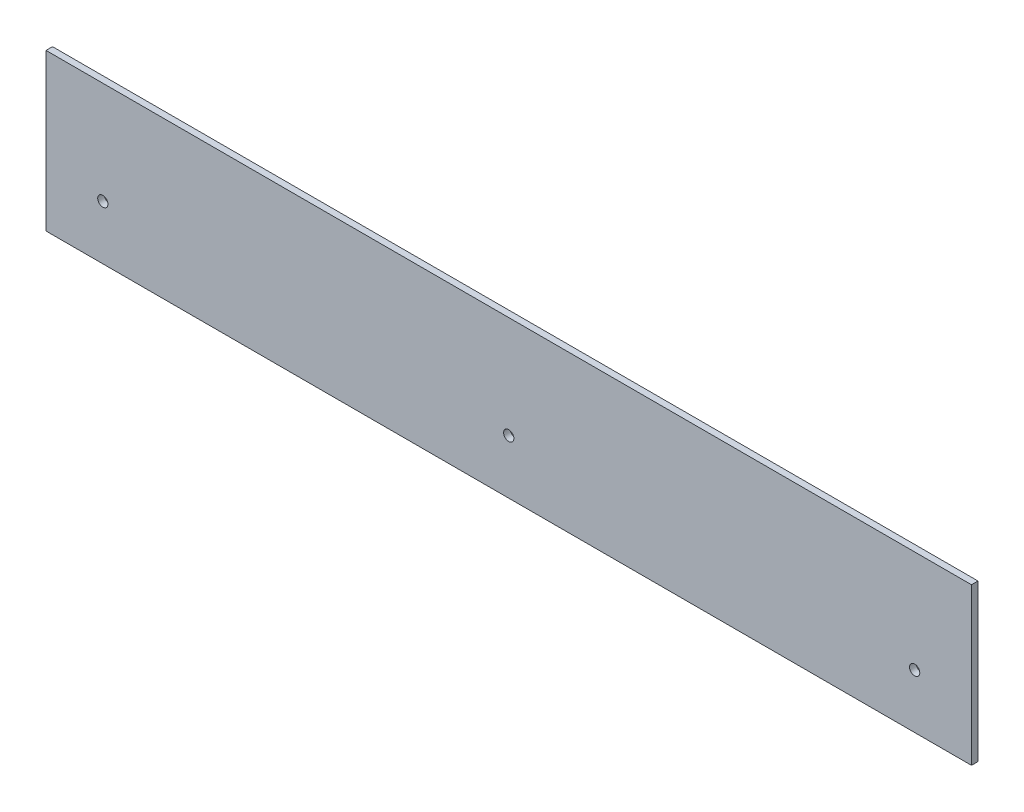
from build123d import *

# Parameters (mm, degrees)
SKETCH1_W           = 450.85
SKETCH1_H           = 76.2
BOSS_EXTRUDE1_DEPTH = 3.175
SKETCH2_R           = 2.5
CUT_EXTRUDE1_DEPTH  = 229.64409297


with BuildPart() as part:
    # Sketch1 → Boss-Extrude1 (new body)
    with BuildSketch(Plane.XY):
        Rectangle(SKETCH1_W, SKETCH1_H)
    extrude(amount=BOSS_EXTRUDE1_DEPTH)

    # Sketch2 → Cut-Extrude1 (cut, through all)
    with BuildSketch(Plane.XY.offset(3.175)):
        with Locations((-197.739, -11.684)):
            Circle(SKETCH2_R)
        with Locations((197.739, -11.684)):
            Circle(SKETCH2_R)
        with Locations((0, -11.684)):
            Circle(SKETCH2_R)
    extrude(amount=-CUT_EXTRUDE1_DEPTH, mode=Mode.SUBTRACT)


solid = part.part
